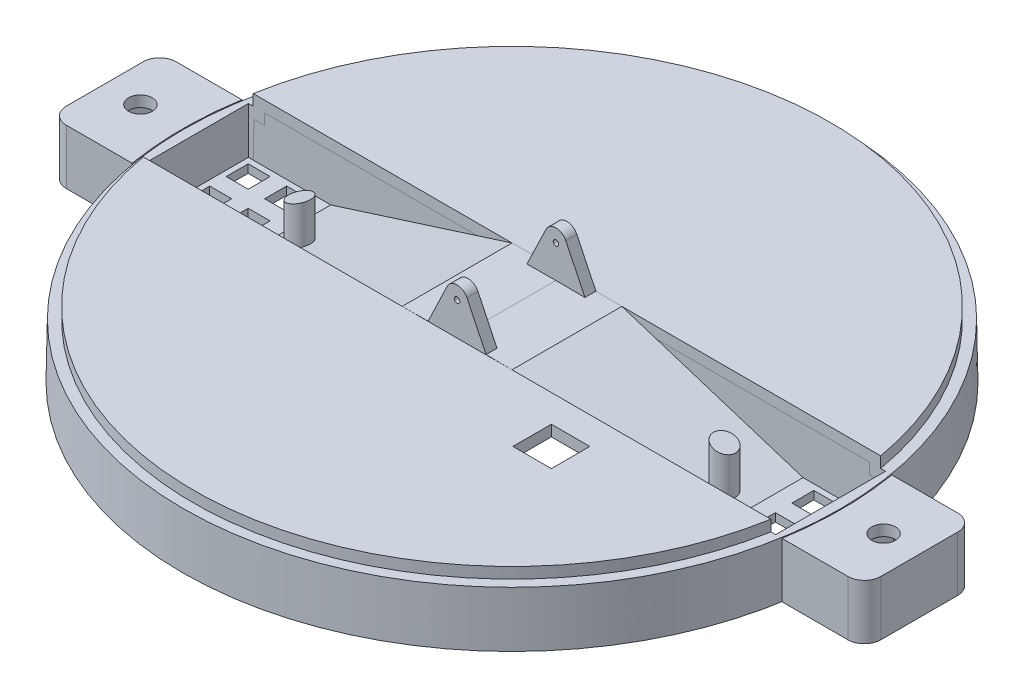
from build123d import *

# Parameters (mm, degrees)
SKETCH1_R                 = 60
BOSS_EXTRUDE1_DEPTH       = 10
BOSS_EXTRUDE1_TAPER       = 1
SKETCH2_R                 = 58
BOSS_EXTRUDE2_DEPTH       = 2
BOSS_EXTRUDE3_DEPTH       = 10
BOSS_EXTRUDE3_2_DEPTH     = 10
SHELL1_T                  = -2
SHELL2_T                  = -2
SHELL3_T                  = -2
CUT_EXTRUDE1_START        = -12
SKETCH4_W                 = 116
SKETCH4_H                 = 20
CUT_EXTRUDE1_DEPTH        = 12
BOSS_EXTRUDE4_DEPTH       = 20
BOSS_EXTRUDE5_DEPTH       = 2
SKETCH7_R                 = 0.5
CUT_EXTRUDE4_DEPTH        = 2
BOSS_EXTRUDE6_START       = 2.231818082
BOSS_EXTRUDE6_OUTLINE_R   = 2
BOSS_EXTRUDE6_DEPTH       = 7
BOSS_EXTRUDE6_START_2     = 9.231818082
BOSS_EXTRUDE6_2_OUTLINE_R = 2
BOSS_EXTRUDE6_2_DEPTH     = 1.272727473
BOSS_EXTRUDE6_START_3     = 21.137626393
BOSS_EXTRUDE6_3_OUTLINE_W = 7
BOSS_EXTRUDE6_3_OUTLINE_H = 8
BOSS_EXTRUDE6_3_DEPTH     = 1.862373607
BOSS_EXTRUDE8_START       = 2.231818082
BOSS_EXTRUDE8_OUTLINE_R   = 2
BOSS_EXTRUDE8_DEPTH       = 7
BOSS_EXTRUDE8_START_2     = 9.231818082
BOSS_EXTRUDE8_2_OUTLINE_R = 2
BOSS_EXTRUDE8_2_DEPTH     = 1.272727473
BOSS_EXTRUDE8_START_3     = -23
BOSS_EXTRUDE8_3_OUTLINE_W = 7
BOSS_EXTRUDE8_3_OUTLINE_H = 8
BOSS_EXTRUDE8_3_DEPTH     = 1.862373607
SKETCH10_R                = 2.15
CUT_EXTRUDE5_DEPTH        = 2
SKETCH11_W                = 4
SKETCH11_H                = 4
CUT_EXTRUDE6_DEPTH        = 1.5
LPATTERN1_COUNT           = 2
LPATTERN1_PITCH           = 7
LPATTERN1_COUNT_DIR2      = 3
LPATTERN1_PITCH_DIR2      = 7
MIRROR7_COPY_1_SKETCH_W   = 4
MIRROR7_COPY_1_SKETCH_H   = 4
MIRROR7_COPY_1_DEPTH      = 1.5
MIRROR7_COPY_2_SKETCH_W   = 4
MIRROR7_COPY_2_SKETCH_H   = 4
MIRROR7_COPY_2_DEPTH      = 1.5
MIRROR7_COPY_3_SKETCH_W   = 4
MIRROR7_COPY_3_SKETCH_H   = 4
MIRROR7_COPY_3_DEPTH      = 1.5
MIRROR7_COPY_4_SKETCH_W   = 4
MIRROR7_COPY_4_SKETCH_H   = 4
MIRROR7_COPY_4_DEPTH      = 1.5
MIRROR7_COPY_5_SKETCH_W   = 4
MIRROR7_COPY_5_SKETCH_H   = 4
MIRROR7_COPY_5_DEPTH      = 1.5
BOSS_EXTRUDE12_DEPTH      = 2
BOSS_EXTRUDE13_DEPTH      = 2
BOSS_EXTRUDE15_DEPTH      = 2
BOSS_EXTRUDE17_DEPTH      = 2
SKETCH19_W                = 7
SKETCH19_H                = 7
CUT_EXTRUDE7_DEPTH        = 2


with BuildPart() as part:
    # Sketch1 → Boss-Extrude1 (new body)
    with BuildSketch(Plane(origin=(0, 0, 0), x_dir=(1, 0, 0), z_dir=(0, 1, 0))):
        Circle(SKETCH1_R)
    extrude(amount=BOSS_EXTRUDE1_DEPTH, taper=BOSS_EXTRUDE1_TAPER)

    # Sketch2 → Boss-Extrude2 (add)
    with BuildSketch(Plane(origin=(0, 10, 0), x_dir=(1, 0, 0), z_dir=(0, 1, 0))):
        with Locations(Location((0, 0, 0), (0, 0, 270))):
            Circle(SKETCH2_R)
    extrude(amount=BOSS_EXTRUDE2_DEPTH)

    # Shell1
    shell1_openings = [part.faces().sort_by_distance(p)[0] for p in [
        (0, 0, 0),
    ]]
    offset(amount=SHELL1_T, openings=shell1_openings, kind=Kind.INTERSECTION)

    # Sketch4 → Cut-Extrude1 (cut)
    with BuildSketch(Plane(origin=(0, 12, 0), x_dir=(1, 0, 0), z_dir=(0, 1, 0)).offset(CUT_EXTRUDE1_START)):
        Rectangle(SKETCH4_W, SKETCH4_H)
    extrude(amount=CUT_EXTRUDE1_DEPTH, mode=Mode.SUBTRACT)

    # Sketch5 → Boss-Extrude4 (add)
    with BuildSketch(Plane.XY.offset(-10)):
        Polygon((0, 12.086815751), (10, 12), (43, 1.5), (59, 1.5), (59, 0), (42.767115837, 0), (9.760766003, 10.502020402), (-0.013021872, 10.586872275), align=None)
    boss_extrude4 = extrude(amount=BOSS_EXTRUDE4_DEPTH)

    # Mirror3: Boss-Extrude4 across plane
    add(boss_extrude4.mirror(Plane(origin=(0, 0, 0), x_dir=(0, 0, 1), z_dir=(1, 0, 0))))

    # Sketch6 → Boss-Extrude5 (add)
    with BuildSketch(Plane.XY.offset(-10)):
        with BuildLine():
            Line((-5.3, 12), (5.3, 12))
            Line((5.3, 12), (1.80176615, 19.26048535))
            ThreePointArc((1.80176615, 19.26048535), (0, 20.392361659), (-1.80176615, 19.26048535))
            Line((-1.80176615, 19.26048535), (-5.3, 12))
        make_face()
    boss_extrude5 = extrude(amount=BOSS_EXTRUDE5_DEPTH)

    # Sketch7 → Cut-Extrude4 (cut)
    with BuildSketch(Plane.XY.offset(-10)):
        with Locations((0, 18)):
            Circle(SKETCH7_R)
    cut_extrude4 = extrude(amount=CUT_EXTRUDE4_DEPTH, mode=Mode.SUBTRACT)

    # Mirror4: Boss-Extrude5, Cut-Extrude4 across plane
    add(boss_extrude5.mirror(Plane.XY))
    add(cut_extrude4.mirror(Plane.XY), mode=Mode.SUBTRACT)

    # Boss-Extrude6: read off the stored shape, not the designer's step
    # Boss-Extrude6 outline → Boss-Extrude6 (add)
    with BuildSketch(Plane(origin=(0, 0, 0), x_dir=(1, 0, 0), z_dir=(0, 1, 0)).offset(BOSS_EXTRUDE6_START)):
        with Locations((38.7, 0)):
            Circle(BOSS_EXTRUDE6_OUTLINE_R)
    extrude(amount=BOSS_EXTRUDE6_DEPTH)

    # Boss-Extrude6 2 outline → Boss-Extrude6 2 (add)
    with BuildSketch(Plane(origin=(0, 0, 0), x_dir=(1, 0, 0), z_dir=(0, 1, 0)).offset(BOSS_EXTRUDE6_START_2)):
        with Locations((38.7, 0)):
            Circle(BOSS_EXTRUDE6_2_OUTLINE_R)
    extrude(amount=BOSS_EXTRUDE6_2_DEPTH)

    # Boss-Extrude6 3 outline → Boss-Extrude6 3 (cut)
    with BuildSketch(Plane(origin=(0, 0, 0), x_dir=(0.9529257800132619, -0.30320365727694704, 0), z_dir=(0.303203657276947, 0.952925780013262, 0)).offset(BOSS_EXTRUDE6_START_3)):
        with Locations((33.5, 0)):
            Rectangle(BOSS_EXTRUDE6_3_OUTLINE_W, BOSS_EXTRUDE6_3_OUTLINE_H)
    extrude(amount=BOSS_EXTRUDE6_3_DEPTH, mode=Mode.SUBTRACT)

    # Boss-Extrude8: read off the stored shape, not the designer's step
    # Boss-Extrude8 outline → Boss-Extrude8 (add)
    with BuildSketch(Plane(origin=(0, 0, 0), x_dir=(1, 0, 0), z_dir=(0, 1, 0)).offset(BOSS_EXTRUDE8_START)):
        with Locations((-38.7, 0)):
            Circle(BOSS_EXTRUDE8_OUTLINE_R)
    extrude(amount=BOSS_EXTRUDE8_DEPTH)

    # Boss-Extrude8 2 outline → Boss-Extrude8 2 (add)
    with BuildSketch(Plane(origin=(0, 0, 0), x_dir=(1, 0, 0), z_dir=(0, 1, 0)).offset(BOSS_EXTRUDE8_START_2)):
        with Locations((-38.7, 0)):
            Circle(BOSS_EXTRUDE8_2_OUTLINE_R)
    extrude(amount=BOSS_EXTRUDE8_2_DEPTH)

    # Boss-Extrude8 3 outline → Boss-Extrude8 3 (cut)
    with BuildSketch(Plane(origin=(0, 0, 0), x_dir=(0.9529257800132619, 0.30320365727694704, 0), z_dir=(0.303203657276947, -0.952925780013262, 0)).offset(BOSS_EXTRUDE8_START_3)):
        with Locations((-33.5, 0)):
            Rectangle(BOSS_EXTRUDE8_3_OUTLINE_W, BOSS_EXTRUDE8_3_OUTLINE_H)
    extrude(amount=BOSS_EXTRUDE8_3_DEPTH, mode=Mode.SUBTRACT)

    # Sketch11 → Cut-Extrude6 (cut)
    with BuildSketch(Plane(origin=(0, 1.5, 0), x_dir=(1, 0, 0), z_dir=(0, 1, 0))):
        with Locations((55, 6.956750778)):
            Rectangle(SKETCH11_W, SKETCH11_H)
    cut_extrude6 = extrude(amount=-CUT_EXTRUDE6_DEPTH, mode=Mode.SUBTRACT)

    # LPattern1: Cut-Extrude6 2 × 3
    with Locations(*[(-i * LPATTERN1_PITCH, 0, j * LPATTERN1_PITCH_DIR2) for i in range(LPATTERN1_COUNT) for j in range(LPATTERN1_COUNT_DIR2) if (i, j) != (0, 0)]):
        add(cut_extrude6, mode=Mode.SUBTRACT)

    # Mirror7: Cut-Extrude6 across plane
    add(cut_extrude6.mirror(Plane(origin=(0, 0, 0), x_dir=(0, 0, 1), z_dir=(1, 0, 0))), mode=Mode.SUBTRACT)

    # Mirror7 copy 1 sketch → Mirror7 copy 1 (cut)
    with BuildSketch(Plane(origin=(0, 1.5, 7), x_dir=(-1, 0, 0), z_dir=(0, 1, 0))):
        with Locations((55, -6.956750778)):
            Rectangle(MIRROR7_COPY_1_SKETCH_W, MIRROR7_COPY_1_SKETCH_H)
    extrude(amount=-MIRROR7_COPY_1_DEPTH, mode=Mode.SUBTRACT)

    # Mirror7 copy 2 sketch → Mirror7 copy 2 (cut)
    with BuildSketch(Plane(origin=(0, 1.5, 14), x_dir=(-1, 0, 0), z_dir=(0, 1, 0))):
        with Locations((55, -6.956750778)):
            Rectangle(MIRROR7_COPY_2_SKETCH_W, MIRROR7_COPY_2_SKETCH_H)
    extrude(amount=-MIRROR7_COPY_2_DEPTH, mode=Mode.SUBTRACT)

    # Mirror7 copy 3 sketch → Mirror7 copy 3 (cut)
    with BuildSketch(Plane(origin=(7, 1.5, 0), x_dir=(-1, 0, 0), z_dir=(0, 1, 0))):
        with Locations((55, -6.956750778)):
            Rectangle(MIRROR7_COPY_3_SKETCH_W, MIRROR7_COPY_3_SKETCH_H)
    extrude(amount=-MIRROR7_COPY_3_DEPTH, mode=Mode.SUBTRACT)

    # Mirror7 copy 4 sketch → Mirror7 copy 4 (cut)
    with BuildSketch(Plane(origin=(7, 1.5, 7), x_dir=(-1, 0, 0), z_dir=(0, 1, 0))):
        with Locations((55, -6.956750778)):
            Rectangle(MIRROR7_COPY_4_SKETCH_W, MIRROR7_COPY_4_SKETCH_H)
    extrude(amount=-MIRROR7_COPY_4_DEPTH, mode=Mode.SUBTRACT)

    # Mirror7 copy 5 sketch → Mirror7 copy 5 (cut)
    with BuildSketch(Plane(origin=(7, 1.5, 14), x_dir=(-1, 0, 0), z_dir=(0, 1, 0))):
        with Locations((55, -6.956750778)):
            Rectangle(MIRROR7_COPY_5_SKETCH_W, MIRROR7_COPY_5_SKETCH_H)
    extrude(amount=-MIRROR7_COPY_5_DEPTH, mode=Mode.SUBTRACT)

    # Sketch19 → Cut-Extrude7 (cut)
    with BuildSketch(Plane(origin=(0, 12, 0), x_dir=(1, 0, 0), z_dir=(0, 1, 0))):
        with Locations((25.660797831, -18.5)):
            Rectangle(SKETCH19_W, SKETCH19_H)
    extrude(amount=-CUT_EXTRUDE7_DEPTH, mode=Mode.SUBTRACT)


with BuildPart() as body_2:
    # Sketch3 → Boss-Extrude3 (new body)
    with BuildSketch(Plane(origin=(0, 0, 0), x_dir=(1, 0, 0), z_dir=(0, 1, 0))):
        with BuildLine():
            Line((59.160797831, 10), (71.160797831, 10))
            ThreePointArc((71.160797831, 10), (73.282118175, 9.121320344), (74.160797831, 7))
            Line((74.160797831, 7), (74.160797831, -7))
            ThreePointArc((74.160797831, -7), (73.282118175, -9.121320344), (71.160797831, -10))
            Line((71.160797831, -10), (59.160797831, -10))
            ThreePointArc((59.160797831, -10), (60, 0), (59.160797831, 10))
        make_face()
    extrude(amount=BOSS_EXTRUDE3_DEPTH)

    # Shell3
    shell3_openings = [body_2.faces().sort_by_distance(p)[0] for p in [
        (66.849937477, 0, 0),
    ]]
    offset(amount=SHELL3_T, openings=shell3_openings, kind=Kind.INTERSECTION)


with BuildPart() as body_3:
    # Sketch3 → Boss-Extrude3 2 (new body)
    with BuildSketch(Plane(origin=(0, 0, 0), x_dir=(1, 0, 0), z_dir=(0, 1, 0))):
        with BuildLine():
            Line((-59.160797831, -10), (-71.160797831, -10))
            ThreePointArc((-71.160797831, -10), (-73.282118175, -9.121320344), (-74.160797831, -7))
            Line((-74.160797831, -7), (-74.160797831, 7))
            ThreePointArc((-74.160797831, 7), (-73.282118175, 9.121320344), (-71.160797831, 10))
            Line((-71.160797831, 10), (-59.160797831, 10))
            ThreePointArc((-59.160797831, 10), (-60, 0), (-59.160797831, -10))
        make_face()
    extrude(amount=BOSS_EXTRUDE3_2_DEPTH)

    # Shell2
    shell2_openings = [body_3.faces().sort_by_distance(p)[0] for p in [
        (-66.849937477, 0, 0),
    ]]
    offset(amount=SHELL2_T, openings=shell2_openings, kind=Kind.INTERSECTION)


with BuildPart() as cut_extrude5_tool:
    # Sketch10 → Cut-Extrude5 (new body)
    with BuildSketch(Plane(origin=(0, 10, 0), x_dir=(1, 0, 0), z_dir=(0, 1, 0))):
        with Locations(Location((67.660797831, 0, 0), (0, 0, 270))):
            Circle(SKETCH10_R)
        with Locations(Location((-67.660797831, 0, 0), (0, 0, 90))):
            Circle(SKETCH10_R)
    extrude(amount=-CUT_EXTRUDE5_DEPTH)


with BuildPart() as body_2_1:
    add(body_2.part)

    # Cut-Extrude5: cut by cut_extrude5_tool
    add(cut_extrude5_tool.part, mode=Mode.SUBTRACT)


with BuildPart() as body_3_1:
    add(body_3.part)

    # Cut-Extrude5: cut by cut_extrude5_tool
    add(cut_extrude5_tool.part, mode=Mode.SUBTRACT)


with BuildPart() as body_4:
    # Sketch12 → Boss-Extrude12 (new body)
    with BuildSketch(Plane.XY.offset(-10)):
        Polygon((-57.104537299, 1.5), (-43, 1.5), (-16.285714286, 10), (-55.099909256, 10), (-55.099909256, 8), (-56.989349393, 8), align=None)
    extrude(amount=-BOSS_EXTRUDE12_DEPTH)


with BuildPart() as body_5:
    # Sketch14 → Boss-Extrude13 (new body)
    with BuildSketch(Plane.XY.offset(-10)):
        Polygon((16.285714286, 10), (43, 1.5), (57.104537299, 1.5), (56.989349393, 8), (55.099909256, 8), (55.099909256, 10), align=None)
    extrude(amount=-BOSS_EXTRUDE13_DEPTH)


with BuildPart() as body_6:
    # Sketch16 → Boss-Extrude15 (new body)
    with BuildSketch(Plane(origin=(0, 0, 10), x_dir=(-1, 0, 0), z_dir=(0, 0, -1))):
        Polygon((-43, 1.5), (-16.285714286, 10), (-55.099909256, 10), (-55.099909256, 8), (-56.989349393, 8), (-57.104537299, 1.5), align=None)
    extrude(amount=-BOSS_EXTRUDE15_DEPTH)


with BuildPart() as body_7:
    # Sketch18 → Boss-Extrude17 (new body)
    with BuildSketch(Plane(origin=(0, 0, 10), x_dir=(-1, 0, 0), z_dir=(0, 0, -1))):
        Polygon((56.989349393, 8), (55.099909256, 8), (55.099909256, 10), (16.285714286, 10), (43, 1.5), (57.104537299, 1.5), align=None)
    extrude(amount=-BOSS_EXTRUDE17_DEPTH)


solid = Compound([part.part, body_2_1.part, body_3_1.part, body_4.part, body_5.part, body_6.part, body_7.part])
